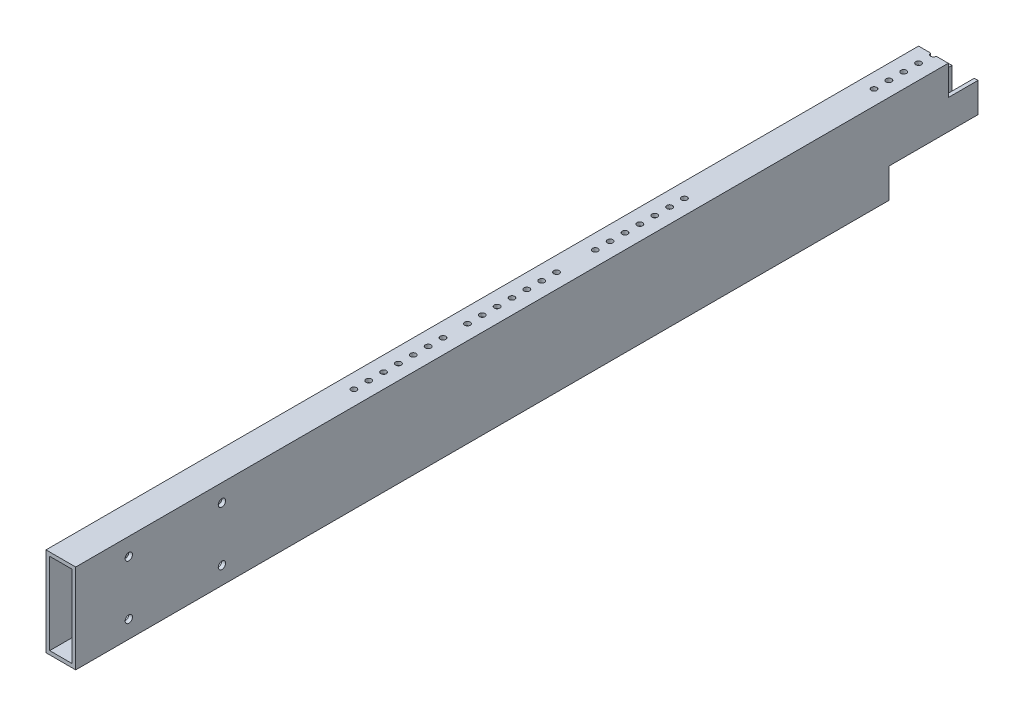
from build123d import *

# Parameters (mm, degrees)
SKETCH1_W                               = 25.4
SKETCH1_H                               = 76.2
BOSS_EXTRUDE1_DEPTH                     = 385.699
SHELL1_T                                = -3.175
SKETCH2_W                               = 76.2
SKETCH2_H                               = 25.4
CUT_EXTRUDE1_DEPTH                      = 389.407632007
SKETCH3_W                               = 25.4
SKETCH3_H                               = 25.4
CUT_EXTRUDE2_DEPTH                      = 389.407632007
SKETCH4_R                               = 2.38125
CUT_EXTRUDE3_DEPTH                      = 394.359185225
CUT_EXTRUDE4_REACH                      = 395.359
SKETCH5_R                               = 2.38125
CUT_EXTRUDE5_REACH                      = 395.359
SKETCH6_R                               = 2.38125
CBORE_FOR_M6_HEX_HEAD_BOLT1_D           = 6.3
CBORE_FOR_M6_HEX_HEAD_BOLT1_CBORE_D     = 14.547
CBORE_FOR_M6_HEX_HEAD_BOLT1_CBORE_DEPTH = 4


with BuildPart() as part:
    # Sketch1 → Boss-Extrude1 (new, symmetric)
    with BuildSketch(Plane.XY):
        Rectangle(SKETCH1_W, SKETCH1_H)
    extrude(amount=BOSS_EXTRUDE1_DEPTH, both=True)

    # Shell1
    shell1_openings = [part.faces().sort_by_distance(p)[0] for p in [
        (0, 0, -385.699),
        (0, 0, 385.699),
    ]]
    offset(amount=SHELL1_T, openings=shell1_openings, kind=Kind.INTERSECTION)

    # Sketch2 → Cut-Extrude1 (cut, through all)
    with BuildSketch(Plane(origin=(12.7, 0, 0), x_dir=(0, 0, -1), z_dir=(1, 0, 0))):
        with Locations((347.599, -25.4)):
            Rectangle(SKETCH2_W, SKETCH2_H)
    extrude(amount=-CUT_EXTRUDE1_DEPTH, mode=Mode.SUBTRACT)

    # Sketch3 → Cut-Extrude2 (cut, through all)
    with BuildSketch(Plane(origin=(12.7, 0, 0), x_dir=(0, 0, -1), z_dir=(1, 0, 0))):
        with Locations((372.999, 25.4)):
            Rectangle(SKETCH3_W, SKETCH3_H)
    extrude(amount=-CUT_EXTRUDE2_DEPTH, mode=Mode.SUBTRACT)

    # Sketch4 → Cut-Extrude3 (cut, through all)
    with BuildSketch(Plane(origin=(0, 38.1, 0), x_dir=(1, 0, 0), z_dir=(0, 1, 0))):
        with Locations((0, 147.394483214)):
            Circle(SKETCH4_R)
        with Locations((0, 134.694483214)):
            Circle(SKETCH4_R)
        with Locations((0, 121.994483214)):
            Circle(SKETCH4_R)
        with Locations((0, 109.294483214)):
            Circle(SKETCH4_R)
        with Locations((0, 96.594483214)):
            Circle(SKETCH4_R)
        with Locations((0, 83.894483214)):
            Circle(SKETCH4_R)
        with Locations((0, 71.194483214)):
            Circle(SKETCH4_R)
        with Locations((0, 38.09873)):
            Circle(SKETCH4_R)
        with Locations((0, 25.39873)):
            Circle(SKETCH4_R)
        with Locations((0, 12.69873)):
            Circle(SKETCH4_R)
        with Locations((0, -0.00127)):
            Circle(SKETCH4_R)
        with Locations((0, -12.70127)):
            Circle(SKETCH4_R)
        with Locations((0, -25.40127)):
            Circle(SKETCH4_R)
        with Locations((0, -38.10127)):
            Circle(SKETCH4_R)
        with Locations((0, -58.99324371)):
            Circle(SKETCH4_R)
        with Locations((0, -71.69324371)):
            Circle(SKETCH4_R)
        with Locations((0, -84.39324371)):
            Circle(SKETCH4_R)
        with Locations((0, -97.09324371)):
            Circle(SKETCH4_R)
        with Locations((0, -109.79324371)):
            Circle(SKETCH4_R)
        with Locations((0, -122.49324371)):
            Circle(SKETCH4_R)
        with Locations((0, -135.19324371)):
            Circle(SKETCH4_R)
    extrude(amount=-CUT_EXTRUDE3_DEPTH, mode=Mode.SUBTRACT)

    # Sketch5 → Cut-Extrude4 (cut, up to next)
    with BuildSketch(Plane(origin=(0, 38.1, 0), x_dir=(1, 0, 0), z_dir=(0, 1, 0)), mode=Mode.PRIVATE) as cut_extrude4_sk1:
        with Locations((0, 360.299)):
            Circle(SKETCH5_R)
    cut_extrude4_tool1 = extrude(cut_extrude4_sk1.sketch, amount=-CUT_EXTRUDE4_REACH, mode=Mode.PRIVATE) & part.part
    # Sketch5 → Cut-Extrude4 (cut, up to next)
    with BuildSketch(Plane(origin=(0, 38.1, 0), x_dir=(1, 0, 0), z_dir=(0, 1, 0)), mode=Mode.PRIVATE) as cut_extrude4_sk2:
        with Locations((0, 347.599)):
            Circle(SKETCH5_R)
    cut_extrude4_tool2 = extrude(cut_extrude4_sk2.sketch, amount=-CUT_EXTRUDE4_REACH, mode=Mode.PRIVATE) & part.part
    # Sketch5 → Cut-Extrude4 (cut, up to next)
    with BuildSketch(Plane(origin=(0, 38.1, 0), x_dir=(1, 0, 0), z_dir=(0, 1, 0)), mode=Mode.PRIVATE) as cut_extrude4_sk3:
        with Locations((0, 334.899)):
            Circle(SKETCH5_R)
    cut_extrude4_tool3 = extrude(cut_extrude4_sk3.sketch, amount=-CUT_EXTRUDE4_REACH, mode=Mode.PRIVATE) & part.part
    # Sketch5 → Cut-Extrude4 (cut, up to next)
    with BuildSketch(Plane(origin=(0, 38.1, 0), x_dir=(1, 0, 0), z_dir=(0, 1, 0)), mode=Mode.PRIVATE) as cut_extrude4_sk4:
        with Locations((0, 322.199)):
            Circle(SKETCH5_R)
    cut_extrude4_tool4 = extrude(cut_extrude4_sk4.sketch, amount=-CUT_EXTRUDE4_REACH, mode=Mode.PRIVATE) & part.part
    # Sketch5 → Cut-Extrude4 (cut, up to next)
    with BuildSketch(Plane(origin=(0, 38.1, 0), x_dir=(1, 0, 0), z_dir=(0, 1, 0)), mode=Mode.PRIVATE) as cut_extrude4_sk5:
        with Locations((0, 309.499)):
            Circle(SKETCH5_R)
    cut_extrude4_tool5 = extrude(cut_extrude4_sk5.sketch, amount=-CUT_EXTRUDE4_REACH, mode=Mode.PRIVATE) & part.part
    add(cut_extrude4_tool1.solids().sort_by_distance((0, 38.1, -360.299))[0], mode=Mode.SUBTRACT)
    add(cut_extrude4_tool2.solids().sort_by_distance((0, 38.1, -347.599))[0], mode=Mode.SUBTRACT)
    add(cut_extrude4_tool3.solids().sort_by_distance((0, 38.1, -334.899))[0], mode=Mode.SUBTRACT)
    add(cut_extrude4_tool4.solids().sort_by_distance((0, 38.1, -322.199))[0], mode=Mode.SUBTRACT)
    add(cut_extrude4_tool5.solids().sort_by_distance((0, 38.1, -309.499))[0], mode=Mode.SUBTRACT)

    # Sketch6 → Cut-Extrude5 (cut, up to next)
    with BuildSketch(Plane.XZ.offset(38.1), mode=Mode.PRIVATE) as cut_extrude5_sk1:
        with Locations((0, -309.499)):
            Circle(SKETCH6_R)
    cut_extrude5_tool1 = extrude(cut_extrude5_sk1.sketch, amount=-CUT_EXTRUDE5_REACH, mode=Mode.PRIVATE) & part.part
    # Sketch6 → Cut-Extrude5 (cut, up to next)
    with BuildSketch(Plane.XZ.offset(38.1), mode=Mode.PRIVATE) as cut_extrude5_sk2:
        with Locations((0, -296.799)):
            Circle(SKETCH6_R)
    cut_extrude5_tool2 = extrude(cut_extrude5_sk2.sketch, amount=-CUT_EXTRUDE5_REACH, mode=Mode.PRIVATE) & part.part
    # Sketch6 → Cut-Extrude5 (cut, up to next)
    with BuildSketch(Plane.XZ.offset(38.1), mode=Mode.PRIVATE) as cut_extrude5_sk3:
        with Locations((0, -284.099)):
            Circle(SKETCH6_R)
    cut_extrude5_tool3 = extrude(cut_extrude5_sk3.sketch, amount=-CUT_EXTRUDE5_REACH, mode=Mode.PRIVATE) & part.part
    # Sketch6 → Cut-Extrude5 (cut, up to next)
    with BuildSketch(Plane.XZ.offset(38.1), mode=Mode.PRIVATE) as cut_extrude5_sk4:
        with Locations((0, -258.699)):
            Circle(SKETCH6_R)
    cut_extrude5_tool4 = extrude(cut_extrude5_sk4.sketch, amount=-CUT_EXTRUDE5_REACH, mode=Mode.PRIVATE) & part.part
    # Sketch6 → Cut-Extrude5 (cut, up to next)
    with BuildSketch(Plane.XZ.offset(38.1), mode=Mode.PRIVATE) as cut_extrude5_sk5:
        with Locations((0, -271.399)):
            Circle(SKETCH6_R)
    cut_extrude5_tool5 = extrude(cut_extrude5_sk5.sketch, amount=-CUT_EXTRUDE5_REACH, mode=Mode.PRIVATE) & part.part
    add(cut_extrude5_tool1.solids().sort_by_distance((0, -38.1, -309.499))[0], mode=Mode.SUBTRACT)
    add(cut_extrude5_tool2.solids().sort_by_distance((0, -38.1, -296.799))[0], mode=Mode.SUBTRACT)
    add(cut_extrude5_tool3.solids().sort_by_distance((0, -38.1, -284.099))[0], mode=Mode.SUBTRACT)
    add(cut_extrude5_tool4.solids().sort_by_distance((0, -38.1, -258.699))[0], mode=Mode.SUBTRACT)
    add(cut_extrude5_tool5.solids().sort_by_distance((0, -38.1, -271.399))[0], mode=Mode.SUBTRACT)

    # CBORE for M6 Hex Head Bolt1 (through all)
    with Locations(Plane.ZY.offset(12.7)):
        with Locations((260.699, 23.1254), (260.699, -23.1), (340.299, 23.1254), (340.299, -23.1)):
            CounterBoreHole(CBORE_FOR_M6_HEX_HEAD_BOLT1_D / 2, CBORE_FOR_M6_HEX_HEAD_BOLT1_CBORE_D / 2, CBORE_FOR_M6_HEX_HEAD_BOLT1_CBORE_DEPTH)


solid = part.part
